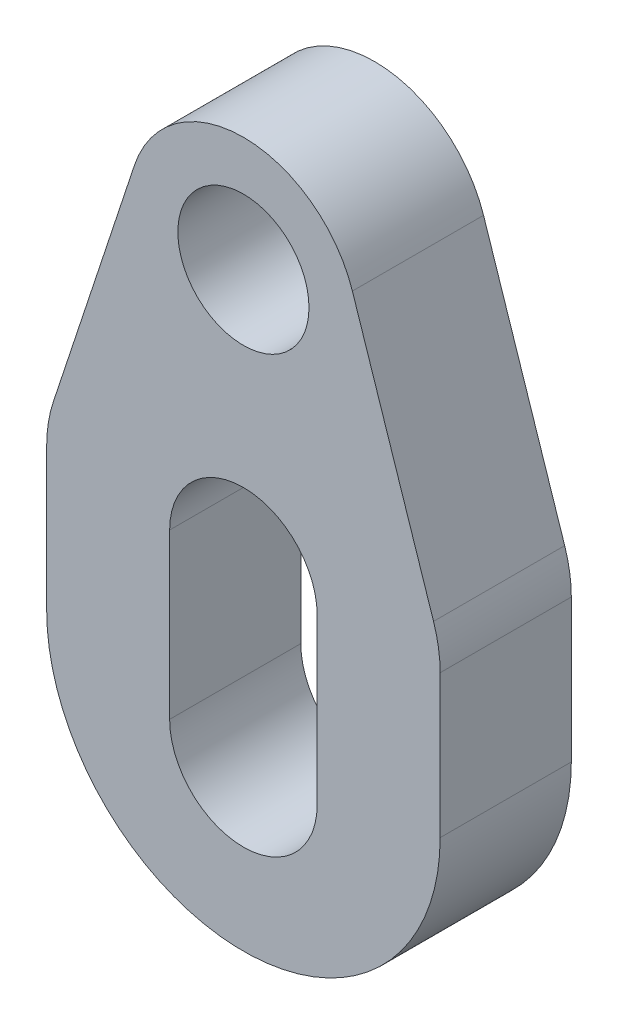
from build123d import *

# Parameters (mm, degrees)
BASE_FLANGE1_DEPTH              = 6.35
F_1_4_0_25_DIAMETER_HOLE1_D     = 6.35
F_9_32_0_28125_DIAMETER_HOLE1_D = 7.14375
CUT_EXTRUDE1_REACH              = 22.88
CUT_EXTRUDE2_DEPTH              = 21.88030247
FILLET1_R                       = 6.35


# Sheet-metal steps are written as plain solids
with BuildPart() as part:
    # Sketch1 → Base-Flange1 (new body)
    with BuildSketch(Plane.XY):
        with BuildLine():
            Line((9.525, 7.9375), (9.525, -7.9375))
            ThreePointArc((9.525, -7.9375), (0, -17.4625), (-9.525, -7.9375))
            Line((-9.525, -7.9375), (-9.525, 7.9375))
            ThreePointArc((-9.525, 7.9375), (0, 17.4625), (9.525, 7.9375))
        make_face()
    extrude(amount=BASE_FLANGE1_DEPTH)

    # 1/4 (0.25) Diameter Hole1 (through all)
    with Locations(Plane.XY.offset(6.35)):
        with Locations((0, 11.1125)):
            Hole(F_1_4_0_25_DIAMETER_HOLE1_D / 2)

    # 9/32 (0.28125) Diameter Hole1 (through all)
    with Locations(Plane.XY.offset(6.35)):
        with Locations((0, -9.525)):
            Hole(F_9_32_0_28125_DIAMETER_HOLE1_D / 2)

    # Sketch6 → Cut-Extrude1 (cut, up to next)
    with BuildSketch(Plane.XY.offset(6.35), mode=Mode.PRIVATE) as cut_extrude1_sk1:
        with BuildLine():
            Line((-3.571875, -9.525), (-3.571875, -1.5875))
            ThreePointArc((-3.571875, -1.5875), (0, 1.984375), (3.571875, -1.5875))
            Line((3.571875, -1.5875), (3.571875, -9.525))
            ThreePointArc((3.571875, -9.525), (0, -13.096875), (-3.571875, -9.525))
        make_face()
    cut_extrude1_tool1 = extrude(cut_extrude1_sk1.sketch, amount=-CUT_EXTRUDE1_REACH, mode=Mode.PRIVATE) & part.part
    add(cut_extrude1_tool1.solids().sort_by_distance((0, -5.55625, 6.35))[0], mode=Mode.SUBTRACT)

    # Sketch7 → Cut-Extrude2 (cut, through all)
    with BuildSketch(Plane.XY.offset(6.35)):
        with BuildLine():
            Line((-4.336848919, 16.417910748), (-9.525, 0))
            Line((-9.525, 0), (-5.27553043, 12.856258225))
            ThreePointArc((-5.27553043, 12.856258225), (-3.89412581, 15.075793862), (-1.650615296, 16.417910748))
            Line((-1.650615296, 16.417910748), (-4.336848919, 16.417910748))
        make_face()
        with BuildLine():
            ThreePointArc((1.650615296, 16.417910748), (3.89412581, 15.075793862), (5.27553043, 12.856258225))
            Line((5.27553043, 12.856258225), (9.525, 0))
            Line((9.525, 0), (4.336848919, 16.417910748))
            Line((4.336848919, 16.417910748), (1.650615296, 16.417910748))
        make_face()
        with BuildLine():
            ThreePointArc((9.525, 7.9375), (8.125088029, 12.908271522), (4.336848919, 16.417910748))
            Line((4.336848919, 16.417910748), (9.525, 0))
            Line((9.525, 0), (9.525, 7.9375))
        make_face()
        with BuildLine():
            Line((-9.525, 7.9375), (-9.525, 0))
            Line((-9.525, 0), (-4.336848919, 16.417910748))
            ThreePointArc((-4.336848919, 16.417910748), (-8.125088029, 12.908271522), (-9.525, 7.9375))
        make_face()
        with BuildLine():
            ThreePointArc((-1e-09, 17.4625), (-2.230438592, 17.197671094), (-4.336848919, 16.417910748))
            Line((-4.336848919, 16.417910748), (-1.650615296, 16.417910748))
            ThreePointArc((-1.650615296, 16.417910748), (0, 16.66875), (1.650615296, 16.417910748))
            Line((1.650615296, 16.417910748), (4.336848919, 16.417910748))
            ThreePointArc((4.336848919, 16.417910748), (2.230438592, 17.197671094), (-1e-09, 17.4625))
        make_face()
    extrude(amount=-CUT_EXTRUDE2_DEPTH, mode=Mode.SUBTRACT)

    # Fillet1
    fillet1_edges = [part.edges().sort_by_distance(p)[0] for p in [
        (9.525, 0, 3.175),
        (-9.525, 0, 3.175),
    ]]
    fillet(fillet1_edges, radius=FILLET1_R)


solid = part.part
